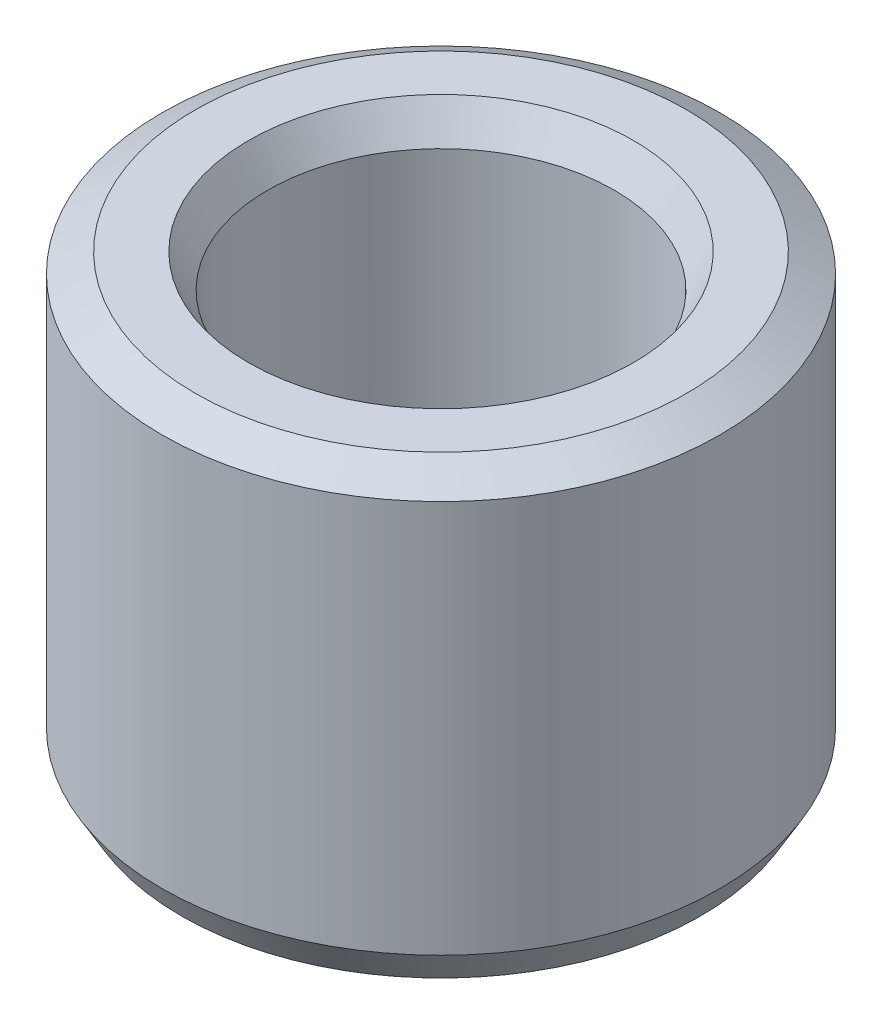
from build123d import *
from OCP.BRepFilletAPI import BRepFilletAPI_MakeChamfer

# Parameters (mm, degrees)
SKETCH1_R           = 25
BOSS_EXTRUDE1_DEPTH = 39.916461372
SKETCH2_R           = 15.520975069
CUT_EXTRUDE1_DEPTH  = 54.322827086
CHAMFER1_SIZE       = 1.725425468
CHAMFER1_SIZE2      = 2.988524575


with BuildPart() as part:
    # Sketch1 → Boss-Extrude1 (new body)
    with BuildSketch(Plane(origin=(0, 0, 0), x_dir=(1, 0, 0), z_dir=(0, 1, 0))):
        Circle(SKETCH1_R)
    extrude(amount=BOSS_EXTRUDE1_DEPTH)

    # Sketch2 → Cut-Extrude1 (cut, through all)
    with BuildSketch(Plane(origin=(0, 0, 0), x_dir=(1, 0, 0), z_dir=(0, 1, 0))):
        Circle(SKETCH2_R)
    extrude(amount=CUT_EXTRUDE1_DEPTH, mode=Mode.SUBTRACT)

    # Chamfer1: one chamfer whose edges measure the first distance from different faces: ONE call of the kernel's chamfer builder (chamfer() names one face for all edges)
    chamfer1_edges_1 = [part.edges().sort_by_distance(p)[0] for p in [
        (-15.520975069, 39.916461372, 0),
    ]]
    chamfer1_side_1 = [part.faces().sort_by_distance(p)[0] for p in [
        (-24.292893219, 39.916461372, 0),
    ]]
    chamfer1_edges_2 = [part.edges().sort_by_distance(p)[0] for p in [
        (-15.520975069, 0, 0),
    ]]
    chamfer1_side_2 = [part.faces().sort_by_distance(p)[0] for p in [
        (-15.520975069, 19.958230686, 0),
    ]]
    chamfer1_edges_3 = [part.edges().sort_by_distance(p)[0] for p in [
        (-25, 0, 0),
    ]]
    chamfer1_side_3 = [part.faces().sort_by_distance(p)[0] for p in [
        (-24.292893219, 0, 0),
    ]]
    chamfer1_edges_4 = [part.edges().sort_by_distance(p)[0] for p in [
        (-25, 39.916461372, 0),
    ]]
    chamfer1_side_4 = [part.faces().sort_by_distance(p)[0] for p in [
        (-25, 19.958230686, 0),
    ]]
    chamfer1 = BRepFilletAPI_MakeChamfer(part.part.solid().wrapped)
    for e in chamfer1_edges_1:
        chamfer1.Add(CHAMFER1_SIZE, CHAMFER1_SIZE2, e.wrapped, chamfer1_side_1[0].wrapped)  # the first distance lies on this face
    for e in chamfer1_edges_2:
        chamfer1.Add(CHAMFER1_SIZE, CHAMFER1_SIZE2, e.wrapped, chamfer1_side_2[0].wrapped)  # the first distance lies on this face
    for e in chamfer1_edges_3:
        chamfer1.Add(CHAMFER1_SIZE, CHAMFER1_SIZE2, e.wrapped, chamfer1_side_3[0].wrapped)  # the first distance lies on this face
    for e in chamfer1_edges_4:
        chamfer1.Add(CHAMFER1_SIZE, CHAMFER1_SIZE2, e.wrapped, chamfer1_side_4[0].wrapped)  # the first distance lies on this face
    add(Compound.cast(chamfer1.Shape()), mode=Mode.REPLACE)


solid = part.part
